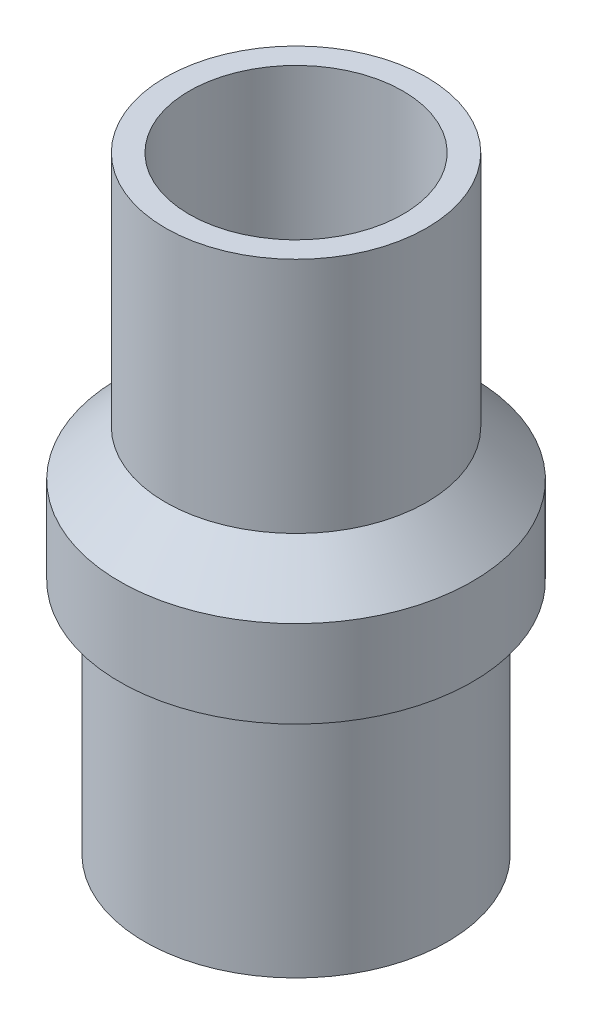
from build123d import *

# Parameters (mm, degrees)
SKETCH3_R           = 10.75
SKETCH3_R_2         = 1.25
BOSS_EXTRUDE1_DEPTH = 2
FILLET1_R           = 0.6


with BuildPart() as part:
    # Sketch1 → Revolve1 (revolve)
    with BuildSketch(Plane.XY, mode=Mode.PRIVATE) as revolve1_sk:
        Polygon((12.85, 3.5), (9, 7.35), (9, 28.178427125), (11, 28.178427125), (11, 8.178427125), (14.85, 4.328427125), (14.85, -3), (12.85, -3), align=None)
        Polygon((10.75, 0), (12.75, 0), (12.75, -1.5), (12.75, -3.1), (13.35, -3.1), (13.35, -3.8), (12.75, -3.8), (12.75, -23), (10.75, -23), align=None)
    revolve(revolve1_sk.sketch.rotate(Axis((0, 0, 0), (0, 1, 0)), 90), axis=Axis((0, 0, 0), (0, 1, 0)))

    # Sketch3 → Boss-Extrude1 (add)
    with BuildSketch(Plane(origin=(0, 0, 0), x_dir=(1, 0, 0), z_dir=(0, 1, 0))):
        with Locations(Location((0, 0, 0), (0, 0, 90))):
            Circle(SKETCH3_R)
        with Locations(Location((0, 0, 0), (0, 0, 270))):
            Circle(SKETCH3_R_2, mode=Mode.SUBTRACT)
        with BuildLine():
            Line((-1.5, 8.874119675), (-1.5, 2.598076211))
            ThreePointArc((-1.5, 2.598076211), (-2.598076211, 1.5), (-3, 0))
            Line((-3, 0), (-8.435213074, -3.138021732))
            ThreePointArc((-8.435213074, -3.138021732), (-7.794228634, 4.5), (-1.5, 8.874119675))
        make_face(mode=Mode.SUBTRACT)
        with BuildLine():
            Line((1.5, 8.874119675), (1.5, 2.598076211))
            ThreePointArc((1.5, 2.598076211), (2.598076211, 1.5), (3, 0))
            Line((3, 0), (8.435213074, -3.138021732))
            ThreePointArc((8.435213074, -3.138021732), (7.794228634, 4.5), (1.5, 8.874119675))
        make_face(mode=Mode.SUBTRACT)
        with BuildLine():
            Line((6.935213074, -5.736097943), (1.5, -2.598076211))
            ThreePointArc((1.5, -2.598076211), (0, -3), (-1.5, -2.598076211))
            Line((-1.5, -2.598076211), (-6.935213074, -5.736097943))
            ThreePointArc((-6.935213074, -5.736097943), (0, -9), (6.935213074, -5.736097943))
        make_face(mode=Mode.SUBTRACT)
    extrude(amount=-BOSS_EXTRUDE1_DEPTH)

    # Fillet1
    fillet1_edges = [part.edges().sort_by_distance(p)[0] for p in [
        (0, -3.1, 12.75),
    ]]
    fillet(fillet1_edges, radius=FILLET1_R - 0.0001)  # a hair under: the kernel refuses the full size


with BuildPart() as body_2:
    # Sketch5 → Revolve2 (revolve)
    with BuildSketch(Plane.XY, mode=Mode.PRIVATE) as revolve2_sk:
        Polygon((-1.25, 0.5), (-1.25, -2.2), (-3, -2.2), (-3, -3.7), (0, -3.7), (0, 0.5), align=None)
    revolve(revolve2_sk.sketch.rotate(Axis((0, 0, 0), (0, 1, 0)), 270), axis=Axis((0, 0, 0), (0, 1, 0)))


solid = Compound([part.part, body_2.part])
